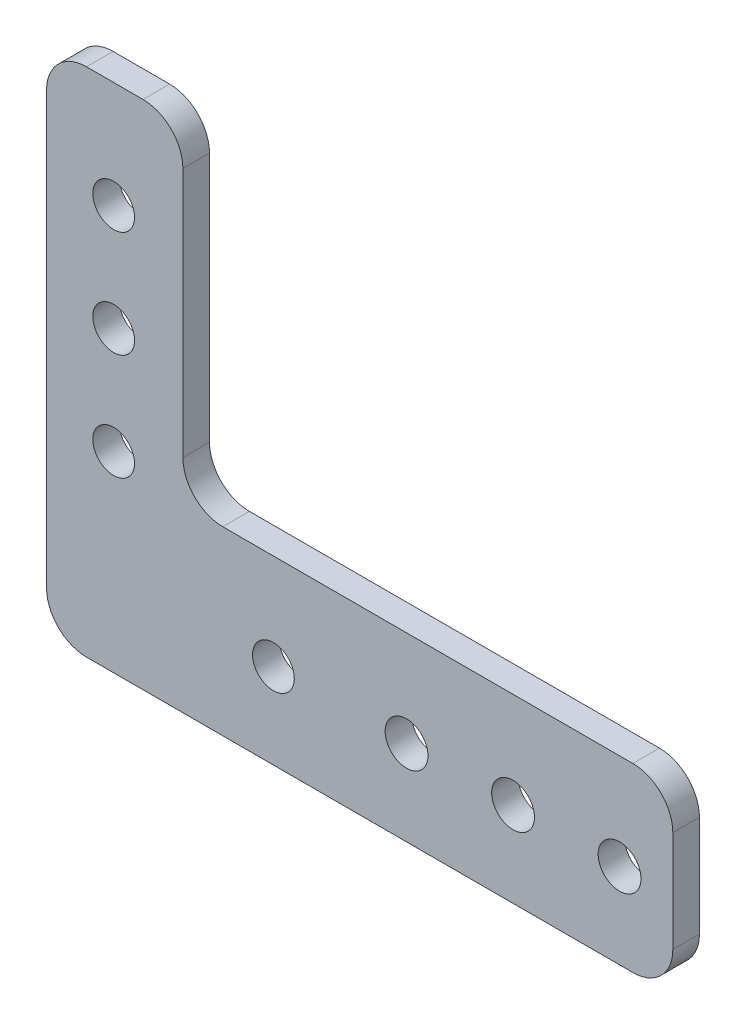
from build123d import *

# Parameters (mm, degrees)
SKETCH1_R           = 2.4892
SKETCH1_R_2         = 2.5527
BOSS_EXTRUDE1_DEPTH = 3.175
FILLET1_R           = 4.7625


with BuildPart() as part:
    # Sketch1 → Boss-Extrude1 (new body)
    with BuildSketch(Plane.XY):
        Polygon((-33.401, 31.75), (-33.401, -29.21), (41.275, -29.21), (41.275, -7.62), (-17.145, -7.62), (-17.145, 31.75), align=None)
        with Locations((-6.35, -19.05)):
            Circle(SKETCH1_R, mode=Mode.SUBTRACT)
        with Locations((-25.4, -6.35)):
            Circle(SKETCH1_R, mode=Mode.SUBTRACT)
        with Locations((9.525, -19.05)):
            Circle(SKETCH1_R_2, mode=Mode.SUBTRACT)
        with Locations((22.225, -19.05)):
            Circle(SKETCH1_R_2, mode=Mode.SUBTRACT)
        with Locations((34.925, -19.05)):
            Circle(SKETCH1_R_2, mode=Mode.SUBTRACT)
        with Locations((-25.4, 6.35)):
            Circle(SKETCH1_R, mode=Mode.SUBTRACT)
        with Locations((-25.4, 19.05)):
            Circle(SKETCH1_R, mode=Mode.SUBTRACT)
    extrude(amount=BOSS_EXTRUDE1_DEPTH)

    # Fillet1
    fillet1_edges = [part.edges().sort_by_distance(p)[0] for p in [
        (-33.401, 31.75, 1.5875),
        (-17.145, 31.75, 1.5875),
        (-17.145, -7.62, 1.5875),
        (41.275, -7.62, 1.5875),
        (41.275, -29.21, 1.5875),
        (-33.401, -29.21, 1.5875),
    ]]
    fillet(fillet1_edges, radius=FILLET1_R)


solid = part.part
